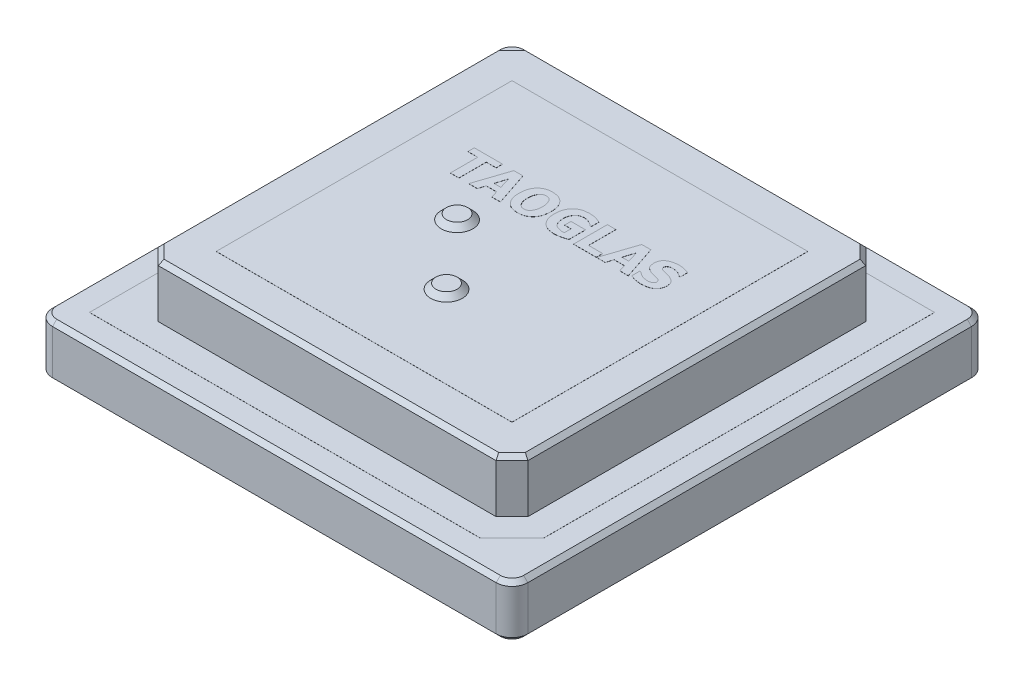
from build123d import *

# Parameters (mm, degrees)
BOSS_EXTRUDE1_DEPTH = 5
CHAMFER1_SIZE       = 0.4
SKETCH2_W           = 35
SKETCH2_H           = 35
BOSS_EXTRUDE2_DEPTH = 5
CHAMFER2_SIZE       = 1.5
CHAMFER3_SIZE       = 0.4
BOSS_EXTRUDE3_DEPTH = 0.01
SKETCH4_W           = 28
SKETCH4_H           = 28
BOSS_EXTRUDE4_DEPTH = 0.01
SKETCH5_R           = 1.5
BOSS_EXTRUDE5_DEPTH = 0.5
CHAMFER4_SIZE       = 0.5
WRAP1_DEPTH         = 0.01
SKETCH7_R           = 8
CUT_EXTRUDE1_DEPTH  = 0.1
SKETCH8_R           = 0.4
BOSS_EXTRUDE7_DEPTH = 3.2


# Read off the part's stored shape, not the designer's step: Wrap1
with BuildPart() as part:
    # Sketch1 → Boss-Extrude1 (new body)
    with BuildSketch(Plane(origin=(0, 0, 0), x_dir=(1, 0, 0), z_dir=(0, 1, 0))):
        with BuildLine():
            Line((-21, 22.5), (21, 22.5))
            ThreePointArc((21, 22.5), (22.060660172, 22.060660172), (22.5, 21))
            Line((22.5, 21), (22.5, -21))
            ThreePointArc((22.5, -21), (22.060660172, -22.060660172), (21, -22.5))
            Line((21, -22.5), (-21, -22.5))
            ThreePointArc((-21, -22.5), (-22.060660172, -22.060660172), (-22.5, -21))
            Line((-22.5, -21), (-22.5, 21))
            ThreePointArc((-22.5, 21), (-22.060660172, 22.060660172), (-21, 22.5))
        make_face()
    extrude(amount=BOSS_EXTRUDE1_DEPTH)

    # Chamfer1
    chamfer1_edges = [part.edges().sort_by_distance(p)[0] for p in [
        (22.5, 0, 0),
        (22.060660172, 0, 22.060660172),
        (0, 0, 22.5),
        (-22.060660172, 0, 22.060660172),
        (22.060660172, 5, 22.060660172),
        (22.5, 5, 0),
        (22.060660172, 5, -22.060660172),
        (0, 5, -22.5),
        (-22.060660172, 5, -22.060660172),
        (-22.5, 5, 0),
        (-22.060660172, 5, 22.060660172),
        (-22.5, 0, 0),
        (0, 5, 22.5),
        (-22.060660172, 0, -22.060660172),
        (0, 0, -22.5),
        (22.060660172, 0, -22.060660172),
    ]]
    chamfer(chamfer1_edges, length=CHAMFER1_SIZE)

    # Sketch2 → Boss-Extrude2 (add)
    with BuildSketch(Plane(origin=(0, 5, 0), x_dir=(1, 0, 0), z_dir=(0, 1, 0))):
        Rectangle(SKETCH2_W, SKETCH2_H)
    extrude(amount=BOSS_EXTRUDE2_DEPTH)

    # Chamfer2
    chamfer2_edges = [part.edges().sort_by_distance(p)[0] for p in [
        (17.5, 7.5, 17.5),
        (17.5, 7.5, -17.5),
        (-17.5, 7.5, -17.5),
        (-17.5, 7.5, 17.5),
    ]]
    chamfer(chamfer2_edges, length=CHAMFER2_SIZE)

    # Chamfer3
    chamfer3_edges = [part.edges().sort_by_distance(p)[0] for p in [
        (-17.5, 10, 0),
        (0, 10, -17.5),
        (17.5, 10, 0),
        (0, 10, 17.5),
        (-16.75, 10, 16.75),
        (16.75, 10, 16.75),
        (16.75, 10, -16.75),
        (-16.75, 10, -16.75),
    ]]
    chamfer(chamfer3_edges, length=CHAMFER3_SIZE)

    # Sketch3 → Boss-Extrude3 (add)
    with BuildSketch(Plane(origin=(0, 5, 0), x_dir=(1, 0, 0), z_dir=(0, 1, 0))):
        Polygon((-20, 17), (-17, 20), (20, 20), (20, -17), (17, -20), (-20, -20), align=None)
        Polygon((-16, -17.5), (-17.5, -16), (-17.5, 16), (-16, 17.5), (16, 17.5), (17.5, 16), (17.5, -16), (16, -17.5), align=None, mode=Mode.SUBTRACT)
    extrude(amount=BOSS_EXTRUDE3_DEPTH)

    # Sketch4 → Boss-Extrude4 (add)
    with BuildSketch(Plane(origin=(0, 10, 0), x_dir=(1, 0, 0), z_dir=(0, 1, 0))):
        Rectangle(SKETCH4_W, SKETCH4_H)
    extrude(amount=BOSS_EXTRUDE4_DEPTH)

    # Sketch5 → Boss-Extrude5 (add)
    with BuildSketch(Plane(origin=(0, 10.01, 0), x_dir=(1, 0, 0), z_dir=(0, 1, 0))):
        with Locations(Location((-5.2, 0, 0), (0, 0, 270))):
            Circle(SKETCH5_R)
        with Locations(Location((0, -6.2, 0), (0, 0, 270))):
            Circle(SKETCH5_R)
    extrude(amount=BOSS_EXTRUDE5_DEPTH)

    # Chamfer4
    chamfer4_edges = [part.edges().sort_by_distance(p)[0] for p in [
        (-5.2, 10.51, -1.5),
        (0, 10.51, 4.7),
    ]]
    chamfer(chamfer4_edges, length=CHAMFER4_SIZE - 0.0001)  # a hair under: the kernel refuses the full size

    # Wrap1 outline → Wrap1 (add)
    # profile 1 of 7: a face of its own
    with BuildSketch(Plane(origin=(0, 10.01, 0), x_dir=(1, 0, 0), z_dir=(0, 1, 0))):
        with BuildLine():
            add(Edge.make_bspline(
                [(-2.917721519, 3.418987342), (-2.728755252, 3.432445978), (-2.351445148, 3.45931892), (-1.808106887, 3.7869863), (-1.443501218, 4.378799241), (-1.412841584, 4.858303231), (-1.397468354, 5.098734177)],
                knots=[0, 0, 0, 0, 0.220514734, 0.440303123, 0.719359061, 1, 1, 1, 1], degree=3))
            add(Edge.make_bspline(
                [(-1.397468354, 5.098734177), (-1.407253218, 5.287446028), (-1.426795359, 5.664337711), (-1.668333847, 6.239772678), (-2.193048062, 6.713422583), (-2.67583387, 6.75845187), (-2.917721519, 6.781012658)],
                knots=[0, 0, 0, 0, 0.221084629, 0.441545975, 0.7202007, 1, 1, 1, 1], degree=3))
            add(Edge.make_bspline(
                [(-2.917721519, 6.781012658), (-3.106730209, 6.767709867), (-3.484132882, 6.741147548), (-4.026646652, 6.411328956), (-4.388092796, 5.818213691), (-4.41963011, 5.339009137), (-4.435443038, 5.098734177)],
                knots=[0, 0, 0, 0, 0.220517142, 0.440317102, 0.719372897, 1, 1, 1, 1], degree=3))
            add(Edge.make_bspline(
                [(-4.435443038, 5.098734177), (-4.425121619, 4.91048338), (-4.404504673, 4.53445402), (-4.163401957, 3.960612663), (-3.641118564, 3.486316497), (-3.159182639, 3.441460993), (-2.917721519, 3.418987342)],
                knots=[0, 0, 0, 0, 0.221052234, 0.441549949, 0.720203522, 1, 1, 1, 1], degree=3))
        make_face()
        with BuildLine():
            add(Edge.make_bspline(
                [(-2.207594937, 5.101265823), (-2.20863185, 4.973274837), (-2.210979872, 4.68344756), (-2.344455854, 4.424803616), (-2.418987342, 4.280379747)],
                knots=[0, 0, 0, 0, 0.441611247, 1, 1, 1, 1], degree=3))
            add(Edge.make_bspline(
                [(-2.418987342, 4.280379747), (-2.476756308, 4.215422039), (-2.607749714, 4.068127877), (-2.804953996, 4.041478886), (-2.915189873, 4.026582278)],
                knots=[0, 0, 0, 0, 0.441006673, 1, 1, 1, 1], degree=3))
            add(Edge.make_bspline(
                [(-2.915189873, 4.026582278), (-3.001470693, 4.035054601), (-3.196912765, 4.054245984), (-3.334935036, 4.196497119), (-3.412025316, 4.275949367)],
                knots=[0, 0, 0, 0, 0.441464922, 1, 1, 1, 1], degree=3))
            add(Edge.make_bspline(
                [(-3.412025316, 4.275949367), (-3.474069871, 4.3877908), (-3.615297774, 4.642368032), (-3.621717217, 4.934783384), (-3.625316456, 5.098734177)],
                knots=[0, 0, 0, 0, 0.439322213, 1, 1, 1, 1], degree=3))
            add(Edge.make_bspline(
                [(-3.625316456, 5.098734177), (-3.622867068, 5.228343005), (-3.617320844, 5.521820271), (-3.482740404, 5.783991572), (-3.407594937, 5.930379747)],
                knots=[0, 0, 0, 0, 0.441631578, 1, 1, 1, 1], degree=3))
            add(Edge.make_bspline(
                [(-3.407594937, 5.930379747), (-3.350140546, 5.9943813), (-3.219984742, 6.139368891), (-3.024424428, 6.161215059), (-2.915189873, 6.173417722)],
                knots=[0, 0, 0, 0, 0.441427801, 1, 1, 1, 1], degree=3))
            add(Edge.make_bspline(
                [(-2.915189873, 6.173417722), (-2.829468712, 6.164931551), (-2.635252367, 6.145704643), (-2.497717342, 6.004712105), (-2.420886076, 5.925949367)],
                knots=[0, 0, 0, 0, 0.441369452, 1, 1, 1, 1], degree=3))
            add(Edge.make_bspline(
                [(-2.420886076, 5.925949367), (-2.359785876, 5.813509033), (-2.220724498, 5.55759976), (-2.212311479, 5.26519501), (-2.207594937, 5.101265823)],
                knots=[0, 0, 0, 0, 0.439375771, 1, 1, 1, 1], degree=3))
        make_face(mode=Mode.SUBTRACT)
    # profile 2 of 7: a face of its own
    with BuildSketch(Plane(origin=(0, 10.01, 0), x_dir=(1, 0, 0), z_dir=(0, 1, 0))):
        with BuildLine():
            Line((0.951898734, 4.634177215), (0.951898734, 3.994936709))
            add(Edge.make_bspline(
                [(0.951898734, 3.994936709), (0.923178482, 3.992466568), (0.857906123, 3.986852692), (0.792386677, 3.986354778), (0.755696203, 3.986075949)],
                knots=[0, 0, 0, 0, 0.440006342, 1, 1, 1, 1], degree=3))
            add(Edge.make_bspline(
                [(0.755696203, 3.986075949), (0.495020548, 4.024332882), (0.067007255, 4.087148397), (-0.241064905, 4.621811509), (-0.255858024, 4.941764505), (-0.263291139, 5.102531646)],
                knots=[0, 0, 0, 0, 0.436632985, 0.716924343, 1, 1, 1, 1], degree=3))
            add(Edge.make_bspline(
                [(-0.263291139, 5.102531646), (-0.258280168, 5.231664814), (-0.246936913, 5.523981449), (-0.083997579, 5.768946427), (0.006962025, 5.905696203)],
                knots=[0, 0, 0, 0, 0.441757852, 1, 1, 1, 1], degree=3))
            add(Edge.make_bspline(
                [(0.006962025, 5.905696203), (0.091122784, 5.977379339), (0.282245725, 6.140166513), (0.534270493, 6.161486157), (0.675316456, 6.173417722)],
                knots=[0, 0, 0, 0, 0.440348801, 1, 1, 1, 1], degree=3))
            add(Edge.make_bspline(
                [(0.675316456, 6.173417722), (0.767861898, 6.167735565), (0.978164198, 6.154823308), (1.170276543, 6.066934216), (1.277848101, 6.017721519)],
                knots=[0, 0, 0, 0, 0.440059105, 1, 1, 1, 1], degree=3))
            add(Edge.make_bspline(
                [(1.277848101, 6.017721519), (1.334381081, 5.984259718), (1.462906892, 5.908185449), (1.582421705, 5.818558396), (1.649367089, 5.76835443)],
                knots=[0, 0, 0, 0, 0.439857011, 1, 1, 1, 1], degree=3))
            Line((1.649367089, 5.76835443), (1.721518987, 5.76835443))
            Line((1.721518987, 5.76835443), (1.721518987, 6.503164557))
            add(Edge.make_bspline(
                [(1.721518987, 6.503164557), (1.561158611, 6.578371034), (1.197299178, 6.749015346), (0.794754928, 6.769535924), (0.569620253, 6.781012658)],
                knots=[0, 0, 0, 0, 0.440720678, 1, 1, 1, 1], degree=3))
            add(Edge.make_bspline(
                [(0.569620253, 6.781012658), (0.374404871, 6.768448876), (-0.01541859, 6.743360398), (-0.590306324, 6.436808452), (-1.013365184, 5.851321563), (-1.053370568, 5.354606022), (-1.073417722, 5.105696203)],
                knots=[0, 0, 0, 0, 0.220703934, 0.440721272, 0.719739055, 1, 1, 1, 1], degree=3))
            add(Edge.make_bspline(
                [(-1.073417722, 5.105696203), (-1.06299129, 4.911182011), (-1.042174472, 4.522826109), (-0.774610391, 3.933294618), (-0.205140755, 3.48293295), (0.290709578, 3.440337236), (0.539240506, 3.418987342)],
                knots=[0, 0, 0, 0, 0.220964701, 0.441165472, 0.719900029, 1, 1, 1, 1], degree=3))
            add(Edge.make_bspline(
                [(0.539240506, 3.418987342), (0.717567066, 3.43044667), (1.122965208, 3.456497698), (1.506624031, 3.591887174), (1.721518987, 3.667721519)],
                knots=[0, 0, 0, 0, 0.439880062, 1, 1, 1, 1], degree=3))
            Line((1.721518987, 3.667721519), (1.721518987, 5.241772152))
            Line((1.721518987, 5.241772152), (0.344303797, 5.241772152))
            Line((0.344303797, 5.241772152), (0.344303797, 4.634177215))
            Line((0.344303797, 4.634177215), (0.951898734, 4.634177215))
        make_face()
    # profile 3 of 7: a face of its own
    with BuildSketch(Plane(origin=(0, 10.01, 0), x_dir=(1, 0, 0), z_dir=(0, 1, 0))):
        with BuildLine():
            add(Edge.make_bspline(
                [(8.906962025, 5.530379747), (8.812405067, 5.552556172), (8.670976323, 5.585725427), (8.505143272, 5.710322817), (8.492431563, 5.809771308), (8.486075949, 5.859493671)],
                knots=[0, 0, 0, 0, 0.50216927, 0.751094058, 1, 1, 1, 1], degree=3))
            add(Edge.make_bspline(
                [(8.486075949, 5.859493671), (8.494677918, 5.911240534), (8.51424492, 6.028949757), (8.614225597, 6.096792271), (8.670253165, 6.134810127)],
                knots=[0, 0, 0, 0, 0.439616045, 1, 1, 1, 1], degree=3))
            add(Edge.make_bspline(
                [(8.670253165, 6.134810127), (8.721228039, 6.157161466), (8.83705153, 6.20794747), (8.963828659, 6.211778877), (9.034810127, 6.213924051)],
                knots=[0, 0, 0, 0, 0.440108258, 1, 1, 1, 1], degree=3))
            add(Edge.make_bspline(
                [(9.034810127, 6.213924051), (9.189393506, 6.198948279), (9.540589639, 6.164925003), (9.831868108, 5.962623211), (9.994936709, 5.849367089)],
                knots=[0, 0, 0, 0, 0.440162532, 1, 1, 1, 1], degree=3))
            Line((9.994936709, 5.849367089), (10.065822785, 5.849367089))
            Line((10.065822785, 5.849367089), (10.065822785, 6.568987342))
            add(Edge.make_bspline(
                [(10.065822785, 6.568987342), (9.914269003, 6.6241385), (9.569886875, 6.749460832), (9.203340141, 6.769687327), (8.998101266, 6.781012658)],
                knots=[0, 0, 0, 0, 0.44007447, 1, 1, 1, 1], degree=3))
            add(Edge.make_bspline(
                [(8.998101266, 6.781012658), (8.72541194, 6.750990206), (8.278962824, 6.70183721), (7.760911188, 6.285822732), (7.704219871, 5.935893249), (7.675949367, 5.761392405)],
                knots=[0, 0, 0, 0, 0.44032578, 0.720904843, 1, 1, 1, 1], degree=3))
            add(Edge.make_bspline(
                [(7.675949367, 5.761392405), (7.698110756, 5.571604262), (7.748319199, 5.141623677), (8.144913335, 4.949240025), (8.366455696, 4.841772152)],
                knots=[0, 0, 0, 0, 0.441387704, 1, 1, 1, 1], degree=3))
            add(Edge.make_bspline(
                [(8.366455696, 4.841772152), (8.467079692, 4.812123734), (8.69582166, 4.74472592), (8.928524378, 4.692527424), (9.058860759, 4.663291139)],
                knots=[0, 0, 0, 0, 0.439901767, 1, 1, 1, 1], degree=3))
            add(Edge.make_bspline(
                [(9.058860759, 4.663291139), (9.129047007, 4.641518398), (9.285061828, 4.593120449), (9.344510589, 4.438731565), (9.37721519, 4.353797468)],
                knots=[0, 0, 0, 0, 0.449869099, 1, 1, 1, 1], degree=3))
            add(Edge.make_bspline(
                [(9.37721519, 4.353797468), (9.370712323, 4.296256173), (9.355945624, 4.165591484), (9.243376427, 4.093911481), (9.180379747, 4.053797468)],
                knots=[0, 0, 0, 0, 0.440373727, 1, 1, 1, 1], degree=3))
            add(Edge.make_bspline(
                [(9.180379747, 4.053797468), (9.129743055, 4.035818112), (9.014467652, 3.994887761), (8.892057258, 3.989241816), (8.823417722, 3.986075949)],
                knots=[0, 0, 0, 0, 0.439267095, 1, 1, 1, 1], degree=3))
            add(Edge.make_bspline(
                [(8.823417722, 3.986075949), (8.648012391, 4.006104624), (8.249502151, 4.051608555), (7.928059877, 4.295245863), (7.748101266, 4.43164557)],
                knots=[0, 0, 0, 0, 0.440152629, 1, 1, 1, 1], degree=3))
            Line((7.748101266, 4.43164557), (7.675949367, 4.43164557))
            Line((7.675949367, 4.43164557), (7.675949367, 3.667088608))
            add(Edge.make_bspline(
                [(7.675949367, 3.667088608), (7.83719047, 3.601424467), (8.203299687, 3.452329438), (8.598888693, 3.43095057), (8.820253165, 3.418987342)],
                knots=[0, 0, 0, 0, 0.440418039, 1, 1, 1, 1], degree=3))
            add(Edge.make_bspline(
                [(8.820253165, 3.418987342), (9.108185245, 3.44461207), (9.5792862, 3.486538048), (10.109374864, 3.940883662), (10.161370285, 4.307844097), (10.187341772, 4.491139241)],
                knots=[0, 0, 0, 0, 0.440329988, 0.720447259, 1, 1, 1, 1], degree=3))
            add(Edge.make_bspline(
                [(10.187341772, 4.491139241), (10.166370751, 4.670619563), (10.118796522, 5.07778324), (9.743440833, 5.260489848), (9.533544304, 5.362658228)],
                knots=[0, 0, 0, 0, 0.440806319, 1, 1, 1, 1], degree=3))
            add(Edge.make_bspline(
                [(9.533544304, 5.362658228), (9.442995217, 5.392143217), (9.237159446, 5.459168361), (9.025506727, 5.504814034), (8.906962025, 5.530379747)],
                knots=[0, 0, 0, 0, 0.439909384, 1, 1, 1, 1], degree=3))
        make_face()
    # profile 4 of 7: a face of its own
    with BuildSketch(Plane(origin=(0, 10.01, 0), x_dir=(1, 0, 0), z_dir=(0, 1, 0))):
        Polygon((-7.594936709, 6.092405063), (-7.594936709, 6.7), (-10.26835443, 6.7), (-10.26835443, 6.092405063), (-9.336708861, 6.092405063), (-9.336708861, 3.5), (-8.526582278, 3.5), (-8.526582278, 6.092405063), align=None)
    # profile 5 of 7: a face of its own
    with BuildSketch(Plane(origin=(0, 10.01, 0), x_dir=(1, 0, 0), z_dir=(0, 1, 0))):
        Polygon((-4.597468354, 3.5), (-5.663924051, 6.7), (-6.528481013, 6.7), (-7.594936709, 3.5), (-6.784177215, 3.5), (-6.587974684, 4.148101266), (-5.605063291, 4.148101266), (-5.408860759, 3.5), align=None)
        Polygon((-5.77278481, 4.715189873), (-6.420253165, 4.715189873), (-6.096202532, 5.774050633), align=None, mode=Mode.SUBTRACT)
    # profile 6 of 7: a face of its own
    with BuildSketch(Plane(origin=(0, 10.01, 0), x_dir=(1, 0, 0), z_dir=(0, 1, 0))):
        Polygon((3.139240506, 4.107594937), (3.139240506, 6.7), (2.329113924, 6.7), (2.329113924, 3.5), (4.475949367, 3.5), (4.475949367, 4.107594937), align=None)
    # profile 7 of 7: a face of its own
    with BuildSketch(Plane(origin=(0, 10.01, 0), x_dir=(1, 0, 0), z_dir=(0, 1, 0))):
        Polygon((7.513924051, 3.5), (6.447468354, 6.7), (5.582911392, 6.7), (4.516455696, 3.5), (5.32721519, 3.5), (5.523417722, 4.148101266), (6.506329114, 4.148101266), (6.702531646, 3.5), align=None)
        Polygon((6.015189873, 5.774050633), (6.338607595, 4.715189873), (5.691139241, 4.715189873), align=None, mode=Mode.SUBTRACT)
    extrude(amount=WRAP1_DEPTH)

    # Sketch7 → Cut-Extrude1 (cut)
    with BuildSketch(Plane.XZ):
        with Locations(Location((1, -1, 0), (0, 0, 270))):
            Circle(SKETCH7_R)
    extrude(amount=-CUT_EXTRUDE1_DEPTH, mode=Mode.SUBTRACT)

    # Sketch8 → Boss-Extrude7 (add)
    with BuildSketch(Plane.XZ.offset(-0.1)):
        with Locations(Location((0, 5.2, 0), (0, 0, 270))):
            Circle(SKETCH8_R)
        with Locations(Location((-5.2, 0, 0), (0, 0, 270))):
            Circle(SKETCH8_R)
        with Locations(Location((7.6, 0, 0), (0, 0, 270))):
            Circle(SKETCH8_R)
    extrude(amount=BOSS_EXTRUDE7_DEPTH)


solid = part.part
